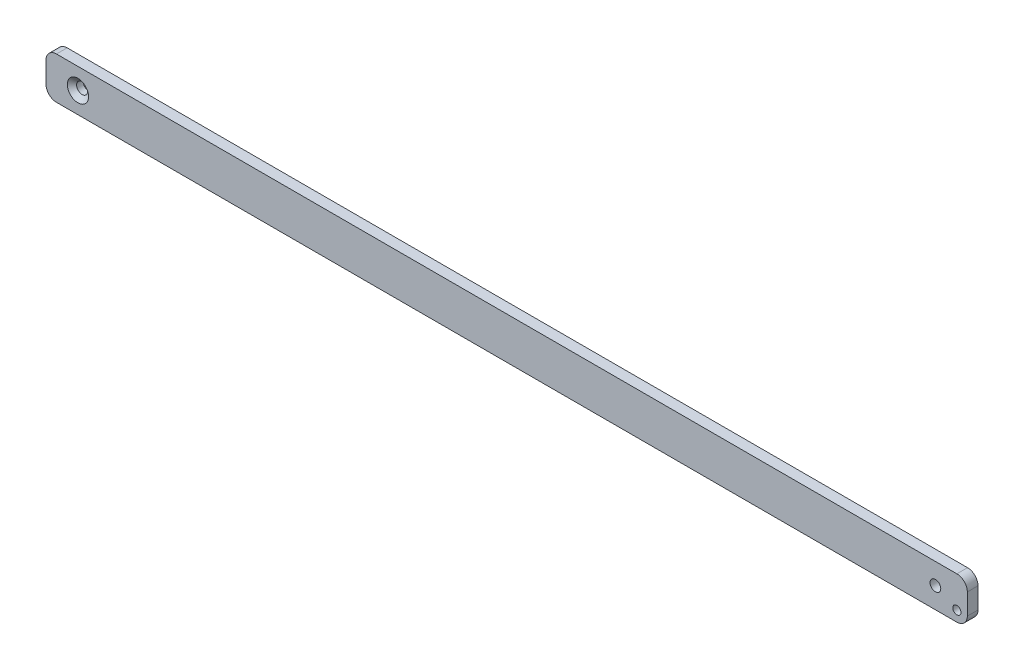
from build123d import *

# Parameters (mm, degrees)
SKETCH1_R                                           = 2.4892
BOSS_EXTRUDE1_DEPTH                                 = 6.477
FILLET2_R                                           = 6.35
CSK_FOR_1_4_FLAT_HEAD_MACHINE_SCREW_100_D           = 6.7564
CSK_FOR_1_4_FLAT_HEAD_MACHINE_SCREW_100_DEPTH       = 19.05
CSK_FOR_1_4_FLAT_HEAD_MACHINE_SCREW_100_CSINK_D     = 12.8778
CSK_FOR_1_4_FLAT_HEAD_MACHINE_SCREW_100_CSINK_ANGLE = 100
CSK_FOR_1_4_FLAT_HEAD_MACHINE_SCREW_100_TIP         = 2.029827343
SKETCH2_R                                           = 3.2639
CUT_EXTRUDE1_DEPTH                                  = 560.414472041


with BuildPart() as part:
    # Sketch1 → Boss-Extrude1 (new body)
    with BuildSketch(Plane.XY):
        Polygon((0, 25.4), (0, 0), (40.53078, 0), (343.71026, 0), (558.8, 0), (558.8, 25.4), (40.530665192, 25.4), align=None)
        with Locations((552.45, 6.35)):
            Circle(SKETCH1_R, mode=Mode.SUBTRACT)
    extrude(amount=BOSS_EXTRUDE1_DEPTH)

    # Fillet2
    fillet2_edges = [part.edges().sort_by_distance(p)[0] for p in [
        (558.8, 25.4, 3.2385),
        (558.8, 0, 3.2385),
        (0, 0, 3.2385),
        (0, 25.4, 3.2385),
    ]]
    fillet(fillet2_edges, radius=FILLET2_R)

    # CSK for 1/4 Flat Head Machine Screw (100)2
    with Locations(Plane.XY.offset(6.477)):
        with Locations((19.3675, 12.7)):
            CounterSinkHole(CSK_FOR_1_4_FLAT_HEAD_MACHINE_SCREW_100_D / 2, CSK_FOR_1_4_FLAT_HEAD_MACHINE_SCREW_100_CSINK_D / 2, depth=CSK_FOR_1_4_FLAT_HEAD_MACHINE_SCREW_100_DEPTH, counter_sink_angle=CSK_FOR_1_4_FLAT_HEAD_MACHINE_SCREW_100_CSINK_ANGLE)
            with Locations((0, 0, -(CSK_FOR_1_4_FLAT_HEAD_MACHINE_SCREW_100_DEPTH + CSK_FOR_1_4_FLAT_HEAD_MACHINE_SCREW_100_TIP / 2))):  # 118° drill point
                Cone(0, CSK_FOR_1_4_FLAT_HEAD_MACHINE_SCREW_100_D / 2, CSK_FOR_1_4_FLAT_HEAD_MACHINE_SCREW_100_TIP, mode=Mode.SUBTRACT)

    # Sketch2 → Cut-Extrude1 (cut, through all)
    with BuildSketch(Plane.XY.offset(6.477)):
        with Locations((539.4325, 12.7)):
            Circle(SKETCH2_R)
    extrude(amount=-CUT_EXTRUDE1_DEPTH, mode=Mode.SUBTRACT)


solid = part.part
